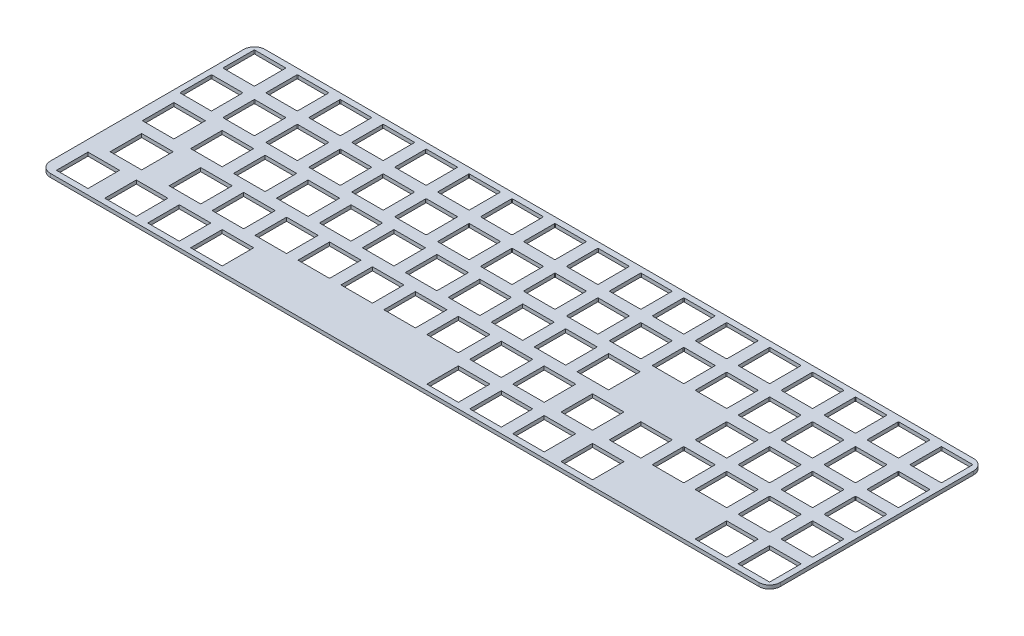
from build123d import *

# Parameters (mm, degrees)
SKETCH2_W           = 13.9954
SKETCH2_H           = 13.9954
BOSS_EXTRUDE1_DEPTH = 0.79375


with BuildPart() as part:
    # Sketch2 → Boss-Extrude1 (new, symmetric)
    with BuildSketch(Plane(origin=(0, 0, 0), x_dir=(1, 0, 0), z_dir=(0, 1, 0))):
        with BuildLine():
            Line((157.1625, -47.625), (-157.1625, -47.625))
            ThreePointArc((-157.1625, -47.625), (-160.530096045, -46.230096045), (-161.925, -42.8625))
            Line((-161.925, -42.8625), (-161.925, 42.8625))
            ThreePointArc((-161.925, 42.8625), (-160.530096045, 46.230096045), (-157.1625, 47.625))
            Line((-157.1625, 47.625), (157.1625, 47.625))
            ThreePointArc((157.1625, 47.625), (160.530096045, 46.230096045), (161.925, 42.8625))
            Line((161.925, 42.8625), (161.925, -42.8625))
            ThreePointArc((161.925, -42.8625), (160.530096045, -46.230096045), (157.1625, -47.625))
        make_face()
        with BuildLine():
            Line((-145.7071, 45.0977), (-159.0929, 45.0977))
            ThreePointArc((-159.0929, 45.0977), (-159.308426147, 45.008426147), (-159.3977, 44.7929))
            Line((-159.3977, 44.7929), (-159.3977, 31.4071))
            ThreePointArc((-159.3977, 31.4071), (-159.308426147, 31.191573853), (-159.0929, 31.1023))
            Line((-159.0929, 31.1023), (-145.7071, 31.1023))
            ThreePointArc((-145.7071, 31.1023), (-145.491573853, 31.191573853), (-145.4023, 31.4071))
            Line((-145.4023, 31.4071), (-145.4023, 44.7929))
            ThreePointArc((-145.4023, 44.7929), (-145.491573853, 45.008426147), (-145.7071, 45.0977))
        make_face(mode=Mode.SUBTRACT)
        with BuildLine():
            Line((-126.6571, 45.0977), (-140.0429, 45.0977))
            ThreePointArc((-140.0429, 45.0977), (-140.258426147, 45.008426147), (-140.3477, 44.7929))
            Line((-140.3477, 44.7929), (-140.3477, 31.4071))
            ThreePointArc((-140.3477, 31.4071), (-140.258426147, 31.191573853), (-140.0429, 31.1023))
            Line((-140.0429, 31.1023), (-126.6571, 31.1023))
            ThreePointArc((-126.6571, 31.1023), (-126.441573853, 31.191573853), (-126.3523, 31.4071))
            Line((-126.3523, 31.4071), (-126.3523, 44.7929))
            ThreePointArc((-126.3523, 44.7929), (-126.441573853, 45.008426147), (-126.6571, 45.0977))
        make_face(mode=Mode.SUBTRACT)
        with BuildLine():
            Line((-107.6071, 45.0977), (-120.9929, 45.0977))
            ThreePointArc((-120.9929, 45.0977), (-121.208426147, 45.008426147), (-121.2977, 44.7929))
            Line((-121.2977, 44.7929), (-121.2977, 31.4071))
            ThreePointArc((-121.2977, 31.4071), (-121.208426147, 31.191573853), (-120.9929, 31.1023))
            Line((-120.9929, 31.1023), (-107.6071, 31.1023))
            ThreePointArc((-107.6071, 31.1023), (-107.391573853, 31.191573853), (-107.3023, 31.4071))
            Line((-107.3023, 31.4071), (-107.3023, 44.7929))
            ThreePointArc((-107.3023, 44.7929), (-107.391573853, 45.008426147), (-107.6071, 45.0977))
        make_face(mode=Mode.SUBTRACT)
        with BuildLine():
            Line((-88.5571, 45.0977), (-101.9429, 45.0977))
            ThreePointArc((-101.9429, 45.0977), (-102.158426147, 45.008426147), (-102.2477, 44.7929))
            Line((-102.2477, 44.7929), (-102.2477, 31.4071))
            ThreePointArc((-102.2477, 31.4071), (-102.158426147, 31.191573853), (-101.9429, 31.1023))
            Line((-101.9429, 31.1023), (-88.5571, 31.1023))
            ThreePointArc((-88.5571, 31.1023), (-88.341573853, 31.191573853), (-88.2523, 31.4071))
            Line((-88.2523, 31.4071), (-88.2523, 44.7929))
            ThreePointArc((-88.2523, 44.7929), (-88.341573853, 45.008426147), (-88.5571, 45.0977))
        make_face(mode=Mode.SUBTRACT)
        with BuildLine():
            Line((-69.5071, 45.0977), (-82.8929, 45.0977))
            ThreePointArc((-82.8929, 45.0977), (-83.108426147, 45.008426147), (-83.1977, 44.7929))
            Line((-83.1977, 44.7929), (-83.1977, 31.4071))
            ThreePointArc((-83.1977, 31.4071), (-83.108426147, 31.191573853), (-82.8929, 31.1023))
            Line((-82.8929, 31.1023), (-69.5071, 31.1023))
            ThreePointArc((-69.5071, 31.1023), (-69.291573853, 31.191573853), (-69.2023, 31.4071))
            Line((-69.2023, 31.4071), (-69.2023, 44.7929))
            ThreePointArc((-69.2023, 44.7929), (-69.291573853, 45.008426147), (-69.5071, 45.0977))
        make_face(mode=Mode.SUBTRACT)
        with BuildLine():
            Line((-50.4571, 45.0977), (-63.8429, 45.0977))
            ThreePointArc((-63.8429, 45.0977), (-64.058426147, 45.008426147), (-64.1477, 44.7929))
            Line((-64.1477, 44.7929), (-64.1477, 31.4071))
            ThreePointArc((-64.1477, 31.4071), (-64.058426147, 31.191573853), (-63.8429, 31.1023))
            Line((-63.8429, 31.1023), (-50.4571, 31.1023))
            ThreePointArc((-50.4571, 31.1023), (-50.241573853, 31.191573853), (-50.1523, 31.4071))
            Line((-50.1523, 31.4071), (-50.1523, 44.7929))
            ThreePointArc((-50.1523, 44.7929), (-50.241573853, 45.008426147), (-50.4571, 45.0977))
        make_face(mode=Mode.SUBTRACT)
        with BuildLine():
            Line((-31.4071, 45.0977), (-44.7929, 45.0977))
            ThreePointArc((-44.7929, 45.0977), (-45.008426147, 45.008426147), (-45.0977, 44.7929))
            Line((-45.0977, 44.7929), (-45.0977, 31.4071))
            ThreePointArc((-45.0977, 31.4071), (-45.008426147, 31.191573853), (-44.7929, 31.1023))
            Line((-44.7929, 31.1023), (-31.4071, 31.1023))
            ThreePointArc((-31.4071, 31.1023), (-31.191573853, 31.191573853), (-31.1023, 31.4071))
            Line((-31.1023, 31.4071), (-31.1023, 44.7929))
            ThreePointArc((-31.1023, 44.7929), (-31.191573853, 45.008426147), (-31.4071, 45.0977))
        make_face(mode=Mode.SUBTRACT)
        with BuildLine():
            Line((-12.3571, 45.0977), (-25.7429, 45.0977))
            ThreePointArc((-25.7429, 45.0977), (-25.958426147, 45.008426147), (-26.0477, 44.7929))
            Line((-26.0477, 44.7929), (-26.0477, 31.4071))
            ThreePointArc((-26.0477, 31.4071), (-25.958426147, 31.191573853), (-25.7429, 31.1023))
            Line((-25.7429, 31.1023), (-12.3571, 31.1023))
            ThreePointArc((-12.3571, 31.1023), (-12.141573853, 31.191573853), (-12.0523, 31.4071))
            Line((-12.0523, 31.4071), (-12.0523, 44.7929))
            ThreePointArc((-12.0523, 44.7929), (-12.141573853, 45.008426147), (-12.3571, 45.0977))
        make_face(mode=Mode.SUBTRACT)
        with BuildLine():
            Line((6.6929, 45.0977), (-6.6929, 45.0977))
            ThreePointArc((-6.6929, 45.0977), (-6.908426147, 45.008426147), (-6.9977, 44.7929))
            Line((-6.9977, 44.7929), (-6.9977, 31.4071))
            ThreePointArc((-6.9977, 31.4071), (-6.908426147, 31.191573853), (-6.6929, 31.1023))
            Line((-6.6929, 31.1023), (6.6929, 31.1023))
            ThreePointArc((6.6929, 31.1023), (6.908426147, 31.191573853), (6.9977, 31.4071))
            Line((6.9977, 31.4071), (6.9977, 44.7929))
            ThreePointArc((6.9977, 44.7929), (6.908426147, 45.008426147), (6.6929, 45.0977))
        make_face(mode=Mode.SUBTRACT)
        with BuildLine():
            Line((25.7429, 45.0977), (12.3571, 45.0977))
            ThreePointArc((12.3571, 45.0977), (12.141573853, 45.008426147), (12.0523, 44.7929))
            Line((12.0523, 44.7929), (12.0523, 31.4071))
            ThreePointArc((12.0523, 31.4071), (12.141573853, 31.191573853), (12.3571, 31.1023))
            Line((12.3571, 31.1023), (25.7429, 31.1023))
            ThreePointArc((25.7429, 31.1023), (25.958426147, 31.191573853), (26.0477, 31.4071))
            Line((26.0477, 31.4071), (26.0477, 44.7929))
            ThreePointArc((26.0477, 44.7929), (25.958426147, 45.008426147), (25.7429, 45.0977))
        make_face(mode=Mode.SUBTRACT)
        with BuildLine():
            Line((44.7929, 45.0977), (31.4071, 45.0977))
            ThreePointArc((31.4071, 45.0977), (31.191573853, 45.008426147), (31.1023, 44.7929))
            Line((31.1023, 44.7929), (31.1023, 31.4071))
            ThreePointArc((31.1023, 31.4071), (31.191573853, 31.191573853), (31.4071, 31.1023))
            Line((31.4071, 31.1023), (44.7929, 31.1023))
            ThreePointArc((44.7929, 31.1023), (45.008426147, 31.191573853), (45.0977, 31.4071))
            Line((45.0977, 31.4071), (45.0977, 44.7929))
            ThreePointArc((45.0977, 44.7929), (45.008426147, 45.008426147), (44.7929, 45.0977))
        make_face(mode=Mode.SUBTRACT)
        with BuildLine():
            Line((63.8429, 45.0977), (50.4571, 45.0977))
            ThreePointArc((50.4571, 45.0977), (50.241573853, 45.008426147), (50.1523, 44.7929))
            Line((50.1523, 44.7929), (50.1523, 31.4071))
            ThreePointArc((50.1523, 31.4071), (50.241573853, 31.191573853), (50.4571, 31.1023))
            Line((50.4571, 31.1023), (63.8429, 31.1023))
            ThreePointArc((63.8429, 31.1023), (64.058426147, 31.191573853), (64.1477, 31.4071))
            Line((64.1477, 31.4071), (64.1477, 44.7929))
            ThreePointArc((64.1477, 44.7929), (64.058426147, 45.008426147), (63.8429, 45.0977))
        make_face(mode=Mode.SUBTRACT)
        with BuildLine():
            Line((82.8929, 45.0977), (69.5071, 45.0977))
            ThreePointArc((69.5071, 45.0977), (69.291573853, 45.008426147), (69.2023, 44.7929))
            Line((69.2023, 44.7929), (69.2023, 31.4071))
            ThreePointArc((69.2023, 31.4071), (69.291573853, 31.191573853), (69.5071, 31.1023))
            Line((69.5071, 31.1023), (82.8929, 31.1023))
            ThreePointArc((82.8929, 31.1023), (83.108426147, 31.191573853), (83.1977, 31.4071))
            Line((83.1977, 31.4071), (83.1977, 44.7929))
            ThreePointArc((83.1977, 44.7929), (83.108426147, 45.008426147), (82.8929, 45.0977))
        make_face(mode=Mode.SUBTRACT)
        with BuildLine():
            Line((101.9429, 45.0977), (88.5571, 45.0977))
            ThreePointArc((88.5571, 45.0977), (88.341573853, 45.008426147), (88.2523, 44.7929))
            Line((88.2523, 44.7929), (88.2523, 31.4071))
            ThreePointArc((88.2523, 31.4071), (88.341573853, 31.191573853), (88.5571, 31.1023))
            Line((88.5571, 31.1023), (101.9429, 31.1023))
            ThreePointArc((101.9429, 31.1023), (102.158426147, 31.191573853), (102.2477, 31.4071))
            Line((102.2477, 31.4071), (102.2477, 44.7929))
            ThreePointArc((102.2477, 44.7929), (102.158426147, 45.008426147), (101.9429, 45.0977))
        make_face(mode=Mode.SUBTRACT)
        with BuildLine():
            Line((120.9929, 45.0977), (107.6071, 45.0977))
            ThreePointArc((107.6071, 45.0977), (107.391573853, 45.008426147), (107.3023, 44.7929))
            Line((107.3023, 44.7929), (107.3023, 31.4071))
            ThreePointArc((107.3023, 31.4071), (107.391573853, 31.191573853), (107.6071, 31.1023))
            Line((107.6071, 31.1023), (120.9929, 31.1023))
            ThreePointArc((120.9929, 31.1023), (121.208426147, 31.191573853), (121.2977, 31.4071))
            Line((121.2977, 31.4071), (121.2977, 44.7929))
            ThreePointArc((121.2977, 44.7929), (121.208426147, 45.008426147), (120.9929, 45.0977))
        make_face(mode=Mode.SUBTRACT)
        with BuildLine():
            Line((140.0429, 45.0977), (126.6571, 45.0977))
            ThreePointArc((126.6571, 45.0977), (126.441573853, 45.008426147), (126.3523, 44.7929))
            Line((126.3523, 44.7929), (126.3523, 31.4071))
            ThreePointArc((126.3523, 31.4071), (126.441573853, 31.191573853), (126.6571, 31.1023))
            Line((126.6571, 31.1023), (140.0429, 31.1023))
            ThreePointArc((140.0429, 31.1023), (140.258426147, 31.191573853), (140.3477, 31.4071))
            Line((140.3477, 31.4071), (140.3477, 44.7929))
            ThreePointArc((140.3477, 44.7929), (140.258426147, 45.008426147), (140.0429, 45.0977))
        make_face(mode=Mode.SUBTRACT)
        with BuildLine():
            Line((159.0929, 45.0977), (145.7071, 45.0977))
            ThreePointArc((145.7071, 45.0977), (145.491573853, 45.008426147), (145.4023, 44.7929))
            Line((145.4023, 44.7929), (145.4023, 31.4071))
            ThreePointArc((145.4023, 31.4071), (145.491573853, 31.191573853), (145.7071, 31.1023))
            Line((145.7071, 31.1023), (159.0929, 31.1023))
            ThreePointArc((159.0929, 31.1023), (159.308426147, 31.191573853), (159.3977, 31.4071))
            Line((159.3977, 31.4071), (159.3977, 44.7929))
            ThreePointArc((159.3977, 44.7929), (159.308426147, 45.008426147), (159.0929, 45.0977))
        make_face(mode=Mode.SUBTRACT)
        with BuildLine():
            Line((-126.6571, 26.0477), (-140.0429, 26.0477))
            ThreePointArc((-140.0429, 26.0477), (-140.258426147, 25.958426147), (-140.3477, 25.7429))
            Line((-140.3477, 25.7429), (-140.3477, 12.3571))
            ThreePointArc((-140.3477, 12.3571), (-140.258426147, 12.141573853), (-140.0429, 12.0523))
            Line((-140.0429, 12.0523), (-126.6571, 12.0523))
            ThreePointArc((-126.6571, 12.0523), (-126.441573853, 12.141573853), (-126.3523, 12.3571))
            Line((-126.3523, 12.3571), (-126.3523, 25.7429))
            ThreePointArc((-126.3523, 25.7429), (-126.441573853, 25.958426147), (-126.6571, 26.0477))
        make_face(mode=Mode.SUBTRACT)
        with BuildLine():
            Line((-107.6071, 26.0477), (-120.9929, 26.0477))
            ThreePointArc((-120.9929, 26.0477), (-121.208426147, 25.958426147), (-121.2977, 25.7429))
            Line((-121.2977, 25.7429), (-121.2977, 12.3571))
            ThreePointArc((-121.2977, 12.3571), (-121.208426147, 12.141573853), (-120.9929, 12.0523))
            Line((-120.9929, 12.0523), (-107.6071, 12.0523))
            ThreePointArc((-107.6071, 12.0523), (-107.391573853, 12.141573853), (-107.3023, 12.3571))
            Line((-107.3023, 12.3571), (-107.3023, 25.7429))
            ThreePointArc((-107.3023, 25.7429), (-107.391573853, 25.958426147), (-107.6071, 26.0477))
        make_face(mode=Mode.SUBTRACT)
        with BuildLine():
            Line((-88.5571, 26.0477), (-101.9429, 26.0477))
            ThreePointArc((-101.9429, 26.0477), (-102.158426147, 25.958426147), (-102.2477, 25.7429))
            Line((-102.2477, 25.7429), (-102.2477, 12.3571))
            ThreePointArc((-102.2477, 12.3571), (-102.158426147, 12.141573853), (-101.9429, 12.0523))
            Line((-101.9429, 12.0523), (-88.5571, 12.0523))
            ThreePointArc((-88.5571, 12.0523), (-88.341573853, 12.141573853), (-88.2523, 12.3571))
            Line((-88.2523, 12.3571), (-88.2523, 25.7429))
            ThreePointArc((-88.2523, 25.7429), (-88.341573853, 25.958426147), (-88.5571, 26.0477))
        make_face(mode=Mode.SUBTRACT)
        with BuildLine():
            Line((-69.5071, 26.0477), (-82.8929, 26.0477))
            ThreePointArc((-82.8929, 26.0477), (-83.108426147, 25.958426147), (-83.1977, 25.7429))
            Line((-83.1977, 25.7429), (-83.1977, 12.3571))
            ThreePointArc((-83.1977, 12.3571), (-83.108426147, 12.141573853), (-82.8929, 12.0523))
            Line((-82.8929, 12.0523), (-69.5071, 12.0523))
            ThreePointArc((-69.5071, 12.0523), (-69.291573853, 12.141573853), (-69.2023, 12.3571))
            Line((-69.2023, 12.3571), (-69.2023, 25.7429))
            ThreePointArc((-69.2023, 25.7429), (-69.291573853, 25.958426147), (-69.5071, 26.0477))
        make_face(mode=Mode.SUBTRACT)
        with BuildLine():
            Line((-50.4571, 26.0477), (-63.8429, 26.0477))
            ThreePointArc((-63.8429, 26.0477), (-64.058426147, 25.958426147), (-64.1477, 25.7429))
            Line((-64.1477, 25.7429), (-64.1477, 12.3571))
            ThreePointArc((-64.1477, 12.3571), (-64.058426147, 12.141573853), (-63.8429, 12.0523))
            Line((-63.8429, 12.0523), (-50.4571, 12.0523))
            ThreePointArc((-50.4571, 12.0523), (-50.241573853, 12.141573853), (-50.1523, 12.3571))
            Line((-50.1523, 12.3571), (-50.1523, 25.7429))
            ThreePointArc((-50.1523, 25.7429), (-50.241573853, 25.958426147), (-50.4571, 26.0477))
        make_face(mode=Mode.SUBTRACT)
        with BuildLine():
            Line((-31.4071, 26.0477), (-44.7929, 26.0477))
            ThreePointArc((-44.7929, 26.0477), (-45.008426147, 25.958426147), (-45.0977, 25.7429))
            Line((-45.0977, 25.7429), (-45.0977, 12.3571))
            ThreePointArc((-45.0977, 12.3571), (-45.008426147, 12.141573853), (-44.7929, 12.0523))
            Line((-44.7929, 12.0523), (-31.4071, 12.0523))
            ThreePointArc((-31.4071, 12.0523), (-31.191573853, 12.141573853), (-31.1023, 12.3571))
            Line((-31.1023, 12.3571), (-31.1023, 25.7429))
            ThreePointArc((-31.1023, 25.7429), (-31.191573853, 25.958426147), (-31.4071, 26.0477))
        make_face(mode=Mode.SUBTRACT)
        with BuildLine():
            Line((-12.3571, 26.0477), (-25.7429, 26.0477))
            ThreePointArc((-25.7429, 26.0477), (-25.958426147, 25.958426147), (-26.0477, 25.7429))
            Line((-26.0477, 25.7429), (-26.0477, 12.3571))
            ThreePointArc((-26.0477, 12.3571), (-25.958426147, 12.141573853), (-25.7429, 12.0523))
            Line((-25.7429, 12.0523), (-12.3571, 12.0523))
            ThreePointArc((-12.3571, 12.0523), (-12.141573853, 12.141573853), (-12.0523, 12.3571))
            Line((-12.0523, 12.3571), (-12.0523, 25.7429))
            ThreePointArc((-12.0523, 25.7429), (-12.141573853, 25.958426147), (-12.3571, 26.0477))
        make_face(mode=Mode.SUBTRACT)
        with BuildLine():
            Line((6.6929, 26.0477), (-6.6929, 26.0477))
            ThreePointArc((-6.6929, 26.0477), (-6.908426147, 25.958426147), (-6.9977, 25.7429))
            Line((-6.9977, 25.7429), (-6.9977, 12.3571))
            ThreePointArc((-6.9977, 12.3571), (-6.908426147, 12.141573853), (-6.6929, 12.0523))
            Line((-6.6929, 12.0523), (6.6929, 12.0523))
            ThreePointArc((6.6929, 12.0523), (6.908426147, 12.141573853), (6.9977, 12.3571))
            Line((6.9977, 12.3571), (6.9977, 25.7429))
            ThreePointArc((6.9977, 25.7429), (6.908426147, 25.958426147), (6.6929, 26.0477))
        make_face(mode=Mode.SUBTRACT)
        with BuildLine():
            Line((25.7429, 26.0477), (12.3571, 26.0477))
            ThreePointArc((12.3571, 26.0477), (12.141573853, 25.958426147), (12.0523, 25.7429))
            Line((12.0523, 25.7429), (12.0523, 12.3571))
            ThreePointArc((12.0523, 12.3571), (12.141573853, 12.141573853), (12.3571, 12.0523))
            Line((12.3571, 12.0523), (25.7429, 12.0523))
            ThreePointArc((25.7429, 12.0523), (25.958426147, 12.141573853), (26.0477, 12.3571))
            Line((26.0477, 12.3571), (26.0477, 25.7429))
            ThreePointArc((26.0477, 25.7429), (25.958426147, 25.958426147), (25.7429, 26.0477))
        make_face(mode=Mode.SUBTRACT)
        with BuildLine():
            Line((44.7929, 26.0477), (31.4071, 26.0477))
            ThreePointArc((31.4071, 26.0477), (31.191573853, 25.958426147), (31.1023, 25.7429))
            Line((31.1023, 25.7429), (31.1023, 12.3571))
            ThreePointArc((31.1023, 12.3571), (31.191573853, 12.141573853), (31.4071, 12.0523))
            Line((31.4071, 12.0523), (44.7929, 12.0523))
            ThreePointArc((44.7929, 12.0523), (45.008426147, 12.141573853), (45.0977, 12.3571))
            Line((45.0977, 12.3571), (45.0977, 25.7429))
            ThreePointArc((45.0977, 25.7429), (45.008426147, 25.958426147), (44.7929, 26.0477))
        make_face(mode=Mode.SUBTRACT)
        with BuildLine():
            Line((63.8429, 26.0477), (50.4571, 26.0477))
            ThreePointArc((50.4571, 26.0477), (50.241573853, 25.958426147), (50.1523, 25.7429))
            Line((50.1523, 25.7429), (50.1523, 12.3571))
            ThreePointArc((50.1523, 12.3571), (50.241573853, 12.141573853), (50.4571, 12.0523))
            Line((50.4571, 12.0523), (63.8429, 12.0523))
            ThreePointArc((63.8429, 12.0523), (64.058426147, 12.141573853), (64.1477, 12.3571))
            Line((64.1477, 12.3571), (64.1477, 25.7429))
            ThreePointArc((64.1477, 25.7429), (64.058426147, 25.958426147), (63.8429, 26.0477))
        make_face(mode=Mode.SUBTRACT)
        with BuildLine():
            Line((82.8929, 26.0477), (69.5071, 26.0477))
            ThreePointArc((69.5071, 26.0477), (69.291573853, 25.958426147), (69.2023, 25.7429))
            Line((69.2023, 25.7429), (69.2023, 12.3571))
            ThreePointArc((69.2023, 12.3571), (69.291573853, 12.141573853), (69.5071, 12.0523))
            Line((69.5071, 12.0523), (82.8929, 12.0523))
            ThreePointArc((82.8929, 12.0523), (83.108426147, 12.141573853), (83.1977, 12.3571))
            Line((83.1977, 12.3571), (83.1977, 25.7429))
            ThreePointArc((83.1977, 25.7429), (83.108426147, 25.958426147), (82.8929, 26.0477))
        make_face(mode=Mode.SUBTRACT)
        with BuildLine():
            Line((101.9429, 26.0477), (88.5571, 26.0477))
            ThreePointArc((88.5571, 26.0477), (88.341573853, 25.958426147), (88.2523, 25.7429))
            Line((88.2523, 25.7429), (88.2523, 12.3571))
            ThreePointArc((88.2523, 12.3571), (88.341573853, 12.141573853), (88.5571, 12.0523))
            Line((88.5571, 12.0523), (101.9429, 12.0523))
            ThreePointArc((101.9429, 12.0523), (102.158426147, 12.141573853), (102.2477, 12.3571))
            Line((102.2477, 12.3571), (102.2477, 25.7429))
            ThreePointArc((102.2477, 25.7429), (102.158426147, 25.958426147), (101.9429, 26.0477))
        make_face(mode=Mode.SUBTRACT)
        with BuildLine():
            Line((120.9929, 26.0477), (107.6071, 26.0477))
            ThreePointArc((107.6071, 26.0477), (107.391573853, 25.958426147), (107.3023, 25.7429))
            Line((107.3023, 25.7429), (107.3023, 12.3571))
            ThreePointArc((107.3023, 12.3571), (107.391573853, 12.141573853), (107.6071, 12.0523))
            Line((107.6071, 12.0523), (120.9929, 12.0523))
            ThreePointArc((120.9929, 12.0523), (121.208426147, 12.141573853), (121.2977, 12.3571))
            Line((121.2977, 12.3571), (121.2977, 25.7429))
            ThreePointArc((121.2977, 25.7429), (121.208426147, 25.958426147), (120.9929, 26.0477))
        make_face(mode=Mode.SUBTRACT)
        with BuildLine():
            Line((140.0429, 26.0477), (126.6571, 26.0477))
            ThreePointArc((126.6571, 26.0477), (126.441573853, 25.958426147), (126.3523, 25.7429))
            Line((126.3523, 25.7429), (126.3523, 12.3571))
            ThreePointArc((126.3523, 12.3571), (126.441573853, 12.141573853), (126.6571, 12.0523))
            Line((126.6571, 12.0523), (140.0429, 12.0523))
            ThreePointArc((140.0429, 12.0523), (140.258426147, 12.141573853), (140.3477, 12.3571))
            Line((140.3477, 12.3571), (140.3477, 25.7429))
            ThreePointArc((140.3477, 25.7429), (140.258426147, 25.958426147), (140.0429, 26.0477))
        make_face(mode=Mode.SUBTRACT)
        with BuildLine():
            Line((159.0929, 26.0477), (145.7071, 26.0477))
            ThreePointArc((145.7071, 26.0477), (145.491573853, 25.958426147), (145.4023, 25.7429))
            Line((145.4023, 25.7429), (145.4023, 12.3571))
            ThreePointArc((145.4023, 12.3571), (145.491573853, 12.141573853), (145.7071, 12.0523))
            Line((145.7071, 12.0523), (159.0929, 12.0523))
            ThreePointArc((159.0929, 12.0523), (159.308426147, 12.141573853), (159.3977, 12.3571))
            Line((159.3977, 12.3571), (159.3977, 25.7429))
            ThreePointArc((159.3977, 25.7429), (159.308426147, 25.958426147), (159.0929, 26.0477))
        make_face(mode=Mode.SUBTRACT)
        with BuildLine():
            Line((-145.7071, 26.0477), (-159.0929, 26.0477))
            ThreePointArc((-159.0929, 26.0477), (-159.308426147, 25.958426147), (-159.3977, 25.7429))
            Line((-159.3977, 25.7429), (-159.3977, 12.3571))
            ThreePointArc((-159.3977, 12.3571), (-159.308426147, 12.141573853), (-159.0929, 12.0523))
            Line((-159.0929, 12.0523), (-145.7071, 12.0523))
            ThreePointArc((-145.7071, 12.0523), (-145.491573853, 12.141573853), (-145.4023, 12.3571))
            Line((-145.4023, 12.3571), (-145.4023, 25.7429))
            ThreePointArc((-145.4023, 25.7429), (-145.491573853, 25.958426147), (-145.7071, 26.0477))
        make_face(mode=Mode.SUBTRACT)
        with Locations((-150.01875, 0)):
            Rectangle(SKETCH2_W, SKETCH2_H, mode=Mode.SUBTRACT)
        with Locations((-145.25625, -19.05)):
            Rectangle(SKETCH2_W, SKETCH2_H, mode=Mode.SUBTRACT)
        with Locations((-150.01875, -38.1)):
            Rectangle(SKETCH2_W, SKETCH2_H, mode=Mode.SUBTRACT)
        with Locations((-128.5875, 0)):
            Rectangle(SKETCH2_W, SKETCH2_H, mode=Mode.SUBTRACT)
        with Locations((-119.0625, -19.05)):
            Rectangle(SKETCH2_W, SKETCH2_H, mode=Mode.SUBTRACT)
        with Locations((-128.5875, -38.1)):
            Rectangle(SKETCH2_W, SKETCH2_H, mode=Mode.SUBTRACT)
        with Locations((-109.5375, 0)):
            Rectangle(SKETCH2_W, SKETCH2_H, mode=Mode.SUBTRACT)
        with Locations((-90.4875, 0)):
            Rectangle(SKETCH2_W, SKETCH2_H, mode=Mode.SUBTRACT)
        with Locations((-71.4375, 0)):
            Rectangle(SKETCH2_W, SKETCH2_H, mode=Mode.SUBTRACT)
        with Locations((-52.3875, 0)):
            Rectangle(SKETCH2_W, SKETCH2_H, mode=Mode.SUBTRACT)
        with Locations((-33.3375, 0)):
            Rectangle(SKETCH2_W, SKETCH2_H, mode=Mode.SUBTRACT)
        with Locations((-14.2875, 0)):
            Rectangle(SKETCH2_W, SKETCH2_H, mode=Mode.SUBTRACT)
        with Locations((4.7625, 0)):
            Rectangle(SKETCH2_W, SKETCH2_H, mode=Mode.SUBTRACT)
        with Locations((23.8125, 0)):
            Rectangle(SKETCH2_W, SKETCH2_H, mode=Mode.SUBTRACT)
        with Locations((42.8625, 0)):
            Rectangle(SKETCH2_W, SKETCH2_H, mode=Mode.SUBTRACT)
        with Locations((-100.0125, -19.05)):
            Rectangle(SKETCH2_W, SKETCH2_H, mode=Mode.SUBTRACT)
        with Locations((-80.9625, -19.05)):
            Rectangle(SKETCH2_W, SKETCH2_H, mode=Mode.SUBTRACT)
        with Locations((-61.9125, -19.05)):
            Rectangle(SKETCH2_W, SKETCH2_H, mode=Mode.SUBTRACT)
        with Locations((-42.8625, -19.05)):
            Rectangle(SKETCH2_W, SKETCH2_H, mode=Mode.SUBTRACT)
        with Locations((-23.8125, -19.05)):
            Rectangle(SKETCH2_W, SKETCH2_H, mode=Mode.SUBTRACT)
        with Locations((-4.7625, -19.05)):
            Rectangle(SKETCH2_W, SKETCH2_H, mode=Mode.SUBTRACT)
        with Locations((14.2875, -19.05)):
            Rectangle(SKETCH2_W, SKETCH2_H, mode=Mode.SUBTRACT)
        with Locations((33.3375, -19.05)):
            Rectangle(SKETCH2_W, SKETCH2_H, mode=Mode.SUBTRACT)
        with Locations((-109.5375, -38.1)):
            Rectangle(SKETCH2_W, SKETCH2_H, mode=Mode.SUBTRACT)
        with Locations((-90.4875, -38.1)):
            Rectangle(SKETCH2_W, SKETCH2_H, mode=Mode.SUBTRACT)
        with BuildLine():
            Line((101.9429, -6.9977), (88.5571, -6.9977))
            ThreePointArc((88.5571, -6.9977), (88.341573853, -6.908426147), (88.2523, -6.6929))
            Line((88.2523, -6.6929), (88.2523, 6.6929))
            ThreePointArc((88.2523, 6.6929), (88.341573853, 6.908426147), (88.5571, 6.9977))
            Line((88.5571, 6.9977), (101.9429, 6.9977))
            ThreePointArc((101.9429, 6.9977), (102.158426147, 6.908426147), (102.2477, 6.6929))
            Line((102.2477, 6.6929), (102.2477, -6.6929))
            ThreePointArc((102.2477, -6.6929), (102.158426147, -6.908426147), (101.9429, -6.9977))
        make_face(mode=Mode.SUBTRACT)
        with Locations((14.2875, -38.1)):
            Rectangle(SKETCH2_W, SKETCH2_H, mode=Mode.SUBTRACT)
        with Locations((33.3375, -38.1)):
            Rectangle(SKETCH2_W, SKETCH2_H, mode=Mode.SUBTRACT)
        with Locations((52.3875, -38.1)):
            Rectangle(SKETCH2_W, SKETCH2_H, mode=Mode.SUBTRACT)
        with Locations((73.81875, -38.1)):
            Rectangle(SKETCH2_W, SKETCH2_H, mode=Mode.SUBTRACT)
        with BuildLine():
            Line((120.9929, -6.9977), (107.6071, -6.9977))
            ThreePointArc((107.6071, -6.9977), (107.391573853, -6.908426147), (107.3023, -6.6929))
            Line((107.3023, -6.6929), (107.3023, 6.6929))
            ThreePointArc((107.3023, 6.6929), (107.391573853, 6.908426147), (107.6071, 6.9977))
            Line((107.6071, 6.9977), (120.9929, 6.9977))
            ThreePointArc((120.9929, 6.9977), (121.208426147, 6.908426147), (121.2977, 6.6929))
            Line((121.2977, 6.6929), (121.2977, -6.6929))
            ThreePointArc((121.2977, -6.6929), (121.208426147, -6.908426147), (120.9929, -6.9977))
        make_face(mode=Mode.SUBTRACT)
        with BuildLine():
            Line((140.0429, 6.9977), (126.6571, 6.9977))
            ThreePointArc((126.6571, 6.9977), (126.441573853, 6.908426147), (126.3523, 6.6929))
            Line((126.3523, 6.6929), (126.3523, -6.6929))
            ThreePointArc((126.3523, -6.6929), (126.441573853, -6.908426147), (126.6571, -6.9977))
            Line((126.6571, -6.9977), (140.0429, -6.9977))
            ThreePointArc((140.0429, -6.9977), (140.258426147, -6.908426147), (140.3477, -6.6929))
            Line((140.3477, -6.6929), (140.3477, 6.6929))
            ThreePointArc((140.3477, 6.6929), (140.258426147, 6.908426147), (140.0429, 6.9977))
        make_face(mode=Mode.SUBTRACT)
        with BuildLine():
            Line((159.3977, 6.6929), (159.3977, -6.6929))
            ThreePointArc((159.3977, -6.6929), (159.308426147, -6.908426147), (159.0929, -6.9977))
            Line((159.0929, -6.9977), (145.7071, -6.9977))
            ThreePointArc((145.7071, -6.9977), (145.491573853, -6.908426147), (145.4023, -6.6929))
            Line((145.4023, -6.6929), (145.4023, 6.6929))
            ThreePointArc((145.4023, 6.6929), (145.491573853, 6.908426147), (145.7071, 6.9977))
            Line((145.7071, 6.9977), (159.0929, 6.9977))
            ThreePointArc((159.0929, 6.9977), (159.308426147, 6.908426147), (159.3977, 6.6929))
        make_face(mode=Mode.SUBTRACT)
        with BuildLine():
            Line((101.9429, -26.0477), (88.5571, -26.0477))
            ThreePointArc((88.5571, -26.0477), (88.341573853, -25.958426147), (88.2523, -25.7429))
            Line((88.2523, -25.7429), (88.2523, -12.3571))
            ThreePointArc((88.2523, -12.3571), (88.341573853, -12.141573853), (88.5571, -12.0523))
            Line((88.5571, -12.0523), (101.9429, -12.0523))
            ThreePointArc((101.9429, -12.0523), (102.158426147, -12.141573853), (102.2477, -12.3571))
            Line((102.2477, -12.3571), (102.2477, -25.7429))
            ThreePointArc((102.2477, -25.7429), (102.158426147, -25.958426147), (101.9429, -26.0477))
        make_face(mode=Mode.SUBTRACT)
        with BuildLine():
            Line((120.9929, -26.0477), (107.6071, -26.0477))
            ThreePointArc((107.6071, -26.0477), (107.391573853, -25.958426147), (107.3023, -25.7429))
            Line((107.3023, -25.7429), (107.3023, -12.3571))
            ThreePointArc((107.3023, -12.3571), (107.391573853, -12.141573853), (107.6071, -12.0523))
            Line((107.6071, -12.0523), (120.9929, -12.0523))
            ThreePointArc((120.9929, -12.0523), (121.208426147, -12.141573853), (121.2977, -12.3571))
            Line((121.2977, -12.3571), (121.2977, -25.7429))
            ThreePointArc((121.2977, -25.7429), (121.208426147, -25.958426147), (120.9929, -26.0477))
        make_face(mode=Mode.SUBTRACT)
        with BuildLine():
            Line((140.0429, -12.0523), (126.6571, -12.0523))
            ThreePointArc((126.6571, -12.0523), (126.441573853, -12.141573853), (126.3523, -12.3571))
            Line((126.3523, -12.3571), (126.3523, -25.7429))
            ThreePointArc((126.3523, -25.7429), (126.441573853, -25.958426147), (126.6571, -26.0477))
            Line((126.6571, -26.0477), (140.0429, -26.0477))
            ThreePointArc((140.0429, -26.0477), (140.258426147, -25.958426147), (140.3477, -25.7429))
            Line((140.3477, -25.7429), (140.3477, -12.3571))
            ThreePointArc((140.3477, -12.3571), (140.258426147, -12.141573853), (140.0429, -12.0523))
        make_face(mode=Mode.SUBTRACT)
        with BuildLine():
            Line((159.3977, -12.3571), (159.3977, -25.7429))
            ThreePointArc((159.3977, -25.7429), (159.308426147, -25.958426147), (159.0929, -26.0477))
            Line((159.0929, -26.0477), (145.7071, -26.0477))
            ThreePointArc((145.7071, -26.0477), (145.491573853, -25.958426147), (145.4023, -25.7429))
            Line((145.4023, -25.7429), (145.4023, -12.3571))
            ThreePointArc((145.4023, -12.3571), (145.491573853, -12.141573853), (145.7071, -12.0523))
            Line((145.7071, -12.0523), (159.0929, -12.0523))
            ThreePointArc((159.0929, -12.0523), (159.308426147, -12.141573853), (159.3977, -12.3571))
        make_face(mode=Mode.SUBTRACT)
        with Locations((152.4, -38.1)):
            Rectangle(SKETCH2_W, SKETCH2_H, mode=Mode.SUBTRACT)
        with Locations((133.35, -38.1)):
            Rectangle(SKETCH2_W, SKETCH2_H, mode=Mode.SUBTRACT)
        with Locations((76.2, -19.05)):
            Rectangle(SKETCH2_W, SKETCH2_H, mode=Mode.SUBTRACT)
        with Locations((54.76875, -19.05)):
            Rectangle(SKETCH2_W, SKETCH2_H, mode=Mode.SUBTRACT)
    extrude(amount=BOSS_EXTRUDE1_DEPTH, both=True)


solid = part.part
